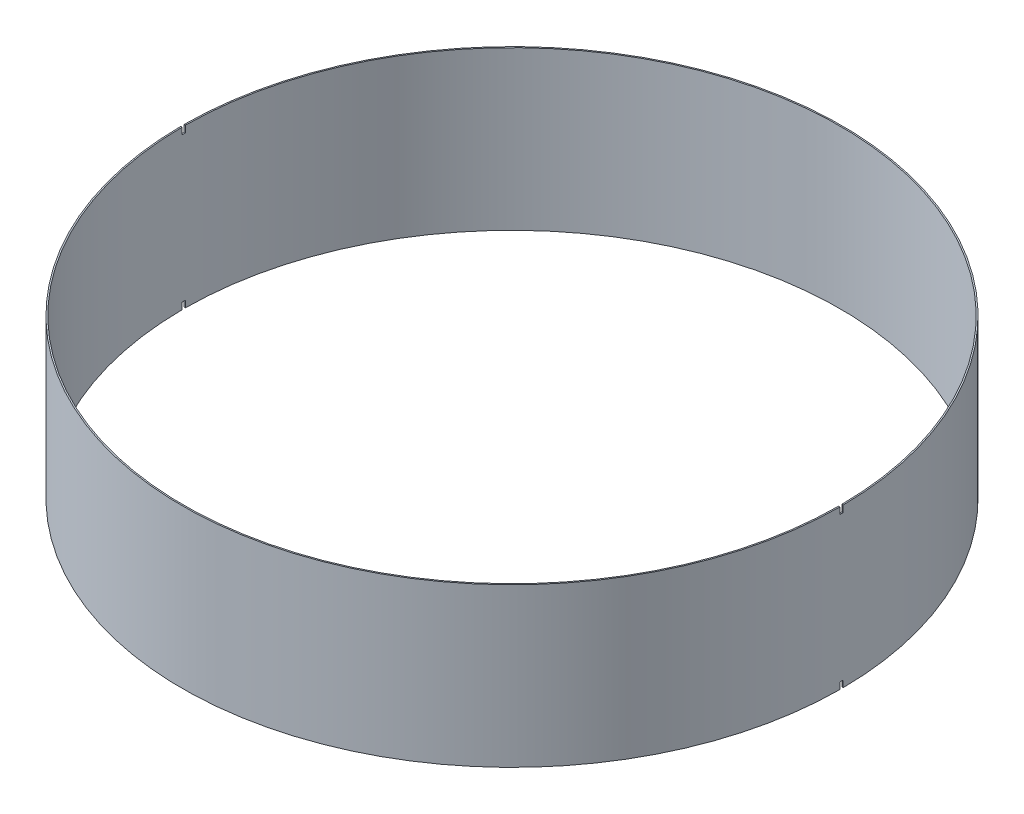
from build123d import *

# Parameters (mm, degrees)
SKETCH_1_R               = 50
SKETCH_1_R_2             = 49.8
EXTRUDE_1_DEPTH          = 24
CUT_EXTRUDE_2_DEPTH      = 52
CUT_EXTRUDE_2_DEPTH_BACK = 52


with BuildPart() as part:
    # Эскиз1 → Бобышка-Вытянуть1 (new body)
    with BuildSketch(Plane(origin=(0, 0, 0), x_dir=(1, 0, 0), z_dir=(0, 1, 0))):
        Circle(SKETCH_1_R)
        Circle(SKETCH_1_R_2, mode=Mode.SUBTRACT)
    extrude(amount=EXTRUDE_1_DEPTH)

    # Эскиз3 → Вырез-Вытянуть2 (cut, two sides: drawn at the far end of the back side and taken through both)
    with BuildSketch(Plane(origin=(0, 0, 0), x_dir=(0, 0, -1), z_dir=(1, 0, 0)).offset(-CUT_EXTRUDE_2_DEPTH_BACK)):
        Polygon((0, 24), (0.25, 24), (0.25, 23), (-0.25, 23), (-0.25, 24), align=None)
        Polygon((0.25, 1), (0.25, 0), (0, 0), (-0.25, 0), (-0.25, 1), align=None)
    extrude(amount=CUT_EXTRUDE_2_DEPTH + CUT_EXTRUDE_2_DEPTH_BACK, mode=Mode.SUBTRACT)


solid = part.part
